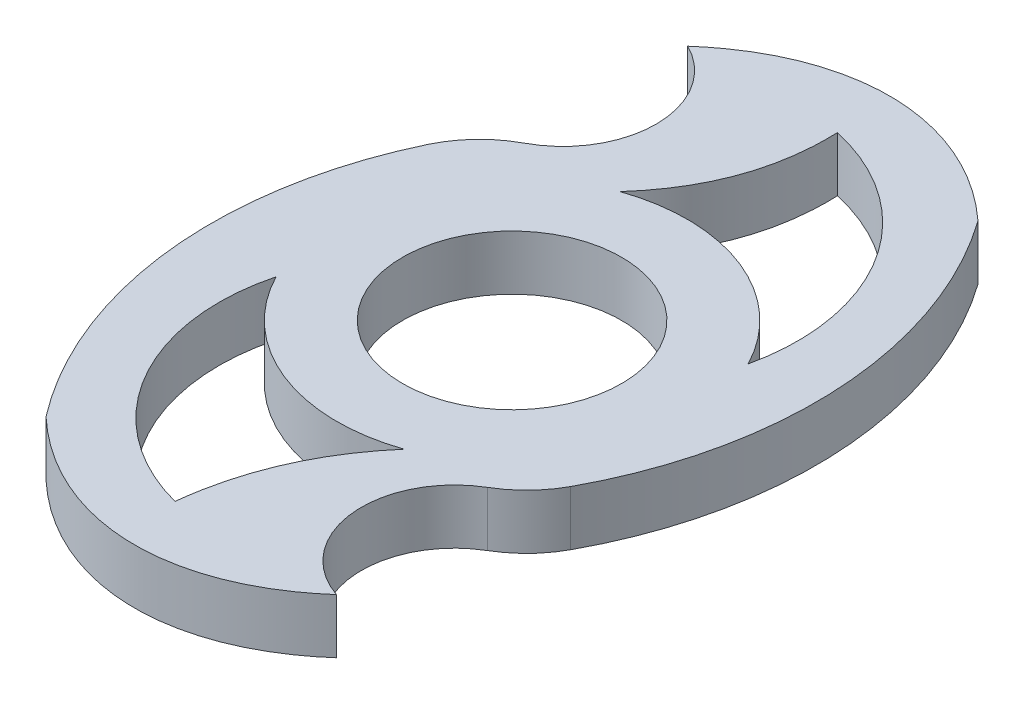
from build123d import *

# Parameters (mm, degrees)
SKETCH2_R           = 20
BOSS_EXTRUDE1_DEPTH = 10


with BuildPart() as part:
    # Sketch2 → Boss-Extrude1 (new body)
    with BuildSketch(Plane(origin=(0, 0, 0), x_dir=(1, 0, 0), z_dir=(0, 1, 0))):
        with BuildLine():
            add(Edge.make_bspline(
                [(26.809775218, 58.280116333), (26.180327137, 58.857594847), (25.539249749, 59.408928803)],
                knots=[2.533598405, 2.533598405, 2.533598405, 2.564884751, 2.564884751, 2.564884751], degree=2, weights=[0.99637781, 0.992080702, 0.988021565]))
            add(Edge.make_bspline(
                [(25.539249749, 59.408928803), (-1.241838692, 82.440974083), (-27.329046807, 59.408928803)],
                knots=[2.564884751, 2.564884751, 2.564884751, 3.676522092, 3.676522092, 3.676522092], degree=2, weights=[0.988021565, 0.843796103, 1]))
            ThreePointArc((-27.329046807, 59.408928803), (-17.881954202, 44.426322804), (-26.887365794, 29.174155637))
            ThreePointArc((-26.887365794, 29.174155637), (-31.939714325, 25.34411631), (-35.539439022, 20.125169191))
            ThreePointArc((-35.539439022, 20.125169191), (-42.419032587, -19.993540693), (-27.329046807, -57.797403189))
            add(Edge.make_bspline(
                [(-27.329046807, -57.797403189), (-26.445893549, -58.629204667), (-25.539249749, -59.408928803)],
                knots=[5.662155253, 5.662155253, 5.662155253, 5.706477404, 5.706477404, 5.706477404], degree=2, weights=[1, 0.993771986, 0.988021565]))
            add(Edge.make_bspline(
                [(-25.539249749, -59.408928803), (1.241838692, -82.440974083), (27.329046807, -59.408928803)],
                knots=[5.706477404, 5.706477404, 5.706477404, 6.818114746, 6.818114746, 6.818114746], degree=2, weights=[0.988021565, 0.843796103, 1]))
            ThreePointArc((27.329046807, -59.408928803), (15.872635623, -45.043181861), (24.17271739, -28.650113659))
            ThreePointArc((24.17271739, -28.650113659), (28.424688091, -25.303153389), (31.623795351, -20.938853831))
            ThreePointArc((31.623795351, -20.938853831), (40.55394361, 19.359573664), (26.809775218, 58.280116333))
        make_face()
        with BuildLine():
            ThreePointArc((-2.152827305, -59.408928803), (-24.569000506, -42.477449509), (-28.44726476, -14.654457605))
            ThreePointArc((-28.44726476, -14.654457605), (-11.870778733, -29.716739597), (10.521139517, -30.220946763))
            add(Edge.make_bspline(
                [(10.521139517, -30.220946763), (-0.330103093, -42.825420059), (-2.152827305, -59.408928803)],
                knots=[0, 0, 0, 1, 1, 1], degree=2))
        make_face(mode=Mode.SUBTRACT)
        Circle(SKETCH2_R, mode=Mode.SUBTRACT)
        with BuildLine():
            add(Edge.make_bspline(
                [(-10.521139517, 30.220946763), (0.663402771, 42.717667068), (0, 59.408928803)],
                knots=[0, 0, 0, 1, 1, 1], degree=2))
            ThreePointArc((0, 59.408928803), (23.492586853, 42.923314642), (28.44726476, 14.654457605))
            ThreePointArc((28.44726476, 14.654457605), (11.870778733, 29.716739597), (-10.521139517, 30.220946763))
        make_face(mode=Mode.SUBTRACT)
    extrude(amount=BOSS_EXTRUDE1_DEPTH)


solid = part.part
